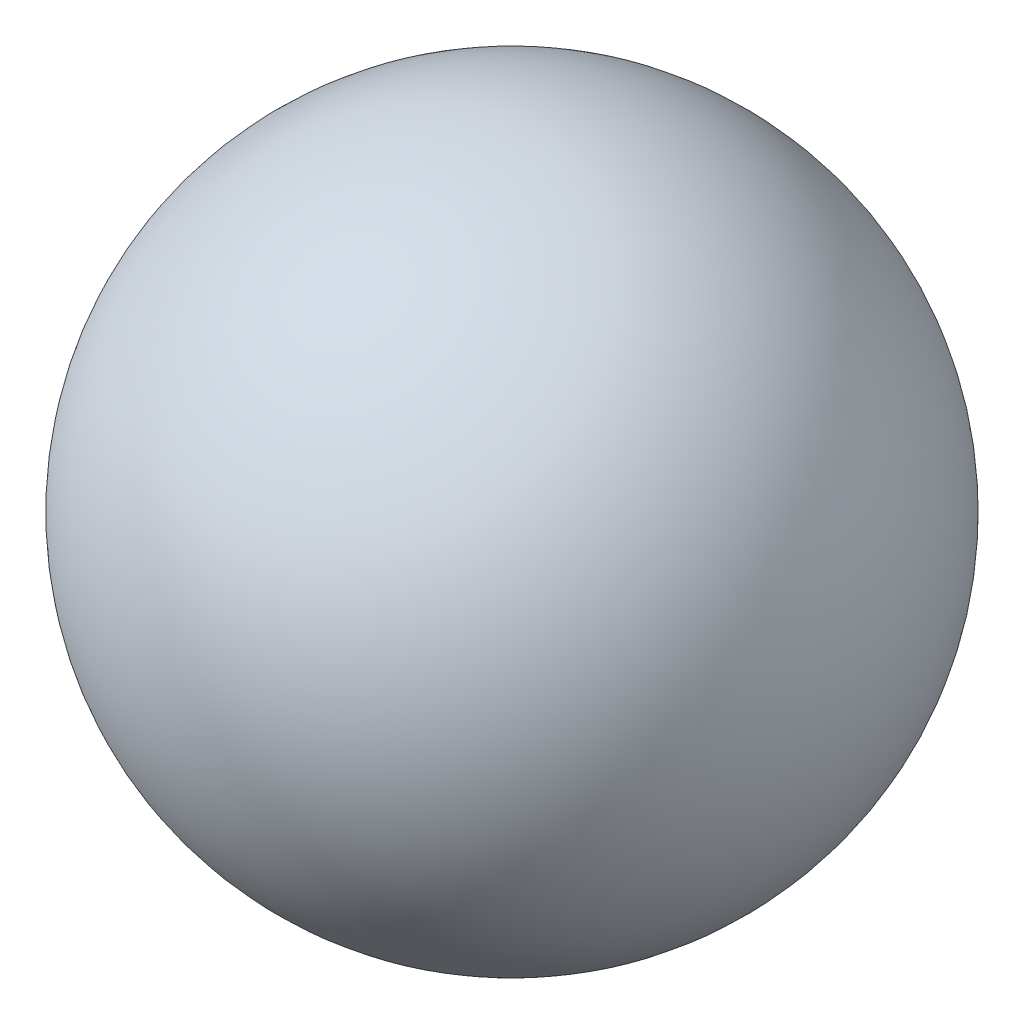
from build123d import *


with BuildPart() as part:
    # Sketch1 → Revolve2 (revolve)
    with BuildSketch(Plane.XY):
        with BuildLine():
            Line((0, 1600), (0, 0))
            Line((0, 0), (0, -1600))
            ThreePointArc((0, -1600), (1131.370849898, -1131.370849898), (1600, 0))
            ThreePointArc((1600, 0), (1131.370849898, 1131.370849898), (0, 1600))
        make_face()
    revolve(axis=Axis((0, 0, 0), (0, 1, 0)))


solid = part.part
